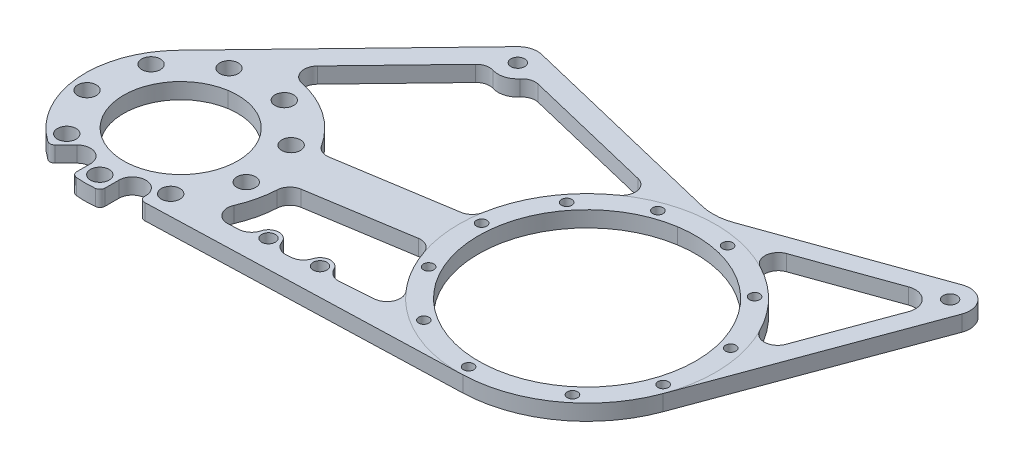
from build123d import *

# Parameters (mm, degrees)
SKETCH3_R             = 52.3875
SKETCH3_R_2           = 27.4955
SKETCH3_R_3           = 4.5
SKETCH3_R_4           = 3.3
BOSS_EXTRUDE2_DEPTH   = 7.62
CIRPATTERN3_OUTLINE_R = 2.5
CIRPATTERN3_DEPTH     = 7.62
CIRPATTERN4_OUTLINE_R = 4.5
CIRPATTERN4_DEPTH     = 7.62
CUT_EXTRUDE1_START    = -7.62
SKETCH5_R             = 3.3
CUT_EXTRUDE1_DEPTH    = 7.62
CUT_EXTRUDE2_START    = -7.62
CUT_EXTRUDE2_DEPTH    = 7.62
FILLET1_R             = 6.5024
FILLET2_R             = 25.4


# Read off the part's stored shape, not the designer's step: CirPattern3, CirPattern4
with BuildPart() as part:
    # Sketch3 → Boss-Extrude2 (new body)
    with BuildSketch(Plane(origin=(0, 0, 0), x_dir=(-1, 0, 0), z_dir=(0, 1, 0))):
        with BuildLine():
            ThreePointArc((-522.50478559, 169.998012211), (-516.00478559, 163.498012211), (-509.50478559, 169.998012211))
            Line((-509.50478559, 169.998012211), (-509.50478559, 176.570745001))
            ThreePointArc((-509.50478559, 176.570745001), (-508.847620296, 178.275600851), (-507.21617656, 179.098273949))
            ThreePointArc((-507.21617656, 179.098273949), (-502.666, 179.324), (-498.11582344, 179.098273949))
            ThreePointArc((-498.11582344, 179.098273949), (-496.484379704, 178.275600851), (-495.82721441, 176.570745001))
            Line((-495.82721441, 176.570745001), (-495.82721441, 169.998012211))
            ThreePointArc((-495.82721441, 169.998012211), (-491.814656721, 163.992795249), (-484.731020333, 165.401818133))
            Line((-484.731020333, 165.401818133), (-479.466136715, 170.666701751))
            ThreePointArc((-479.466136715, 170.666701751), (-477.888500119, 171.401242365), (-476.208336104, 170.947881552))
            ThreePointArc((-476.208336104, 170.947881552), (-456.900912757, 137.72783801), (-469.560234588, 101.449890714))
            Line((-469.560234588, 101.449890714), (-549.824285574, 18.152281318))
            ThreePointArc((-549.824285574, 18.152281318), (-554.019455529, 15.616475413), (-558.920153879, 15.502817016))
            Line((-558.920153879, 15.502817016), (-668.387105519, 41.950748201))
            Line((-668.387105519, 41.950748201), (-756.608134198, 10.378338241))
            ThreePointArc((-756.608134198, 10.378338241), (-766.585677978, 12.644204969), (-768.753729938, 22.643459071))
            Line((-768.753729938, 22.643459071), (-729.914918061, 127.907761748))
            ThreePointArc((-729.914918061, 127.907761748), (-708.037423823, 156.697788747), (-673.809574181, 168.357322083))
            Line((-673.809574181, 168.357322083), (-525.125998889, 173.113723975))
            ThreePointArc((-525.125998889, 173.113723975), (-523.277680865, 172.399561195), (-522.50478559, 170.575022653))
            Line((-522.50478559, 170.575022653), (-522.50478559, 169.998012211))
        make_face()
        with Locations(Location((-671.83, 106.476477371, 0), (0, 0, 270))):
            Circle(SKETCH3_R, mode=Mode.SUBTRACT)
        with Locations(Location((-502.666, 133.35, 0), (0, 0, 270))):
            Circle(SKETCH3_R_2, mode=Mode.SUBTRACT)
        with Locations(Location((-502.666, 172.35, 0), (0, 0, 270))):
            Circle(SKETCH3_R_3, mode=Mode.SUBTRACT)
        with Locations(Location((-556.683214872, 24.761419982, 0), (0, 0, 270))):
            Circle(SKETCH3_R_4, mode=Mode.SUBTRACT)
        with BuildLine():
            ThreePointArc((-757.653004828, 16.85543963), (-757.32668993, 21.510922268), (-761.982172567, 21.837237166))
            ThreePointArc((-761.982172567, 21.837237166), (-762.308487465, 17.181754528), (-757.653004828, 16.85543963))
        make_face(mode=Mode.SUBTRACT)
        with BuildLine():
            ThreePointArc((-671.83, 161.126477371), (-669.33, 163.626477371), (-671.83, 166.126477371))
            ThreePointArc((-671.83, 166.126477371), (-674.33, 163.626477371), (-671.83, 161.126477371))
        make_face(mode=Mode.SUBTRACT)
    extrude(amount=BOSS_EXTRUDE2_DEPTH)

    # CirPattern3 outline → CirPattern3 (cut)
    with BuildSketch(Plane(origin=(0, 0, 0), x_dir=(1, 0, 0), z_dir=(0, 1, 0))):
        with Locations((708.565311894, -150.255917295)):
            Circle(CIRPATTERN3_OUTLINE_R)
        with Locations((726.182879906, -124.1367986)):
            Circle(CIRPATTERN3_OUTLINE_R)
        with Locations((727.282400757, -92.650641038)):
            Circle(CIRPATTERN3_OUTLINE_R)
        with Locations((711.529725872, -65.366207782)):
            Circle(CIRPATTERN3_OUTLINE_R)
        with Locations((683.71215313, -50.575341989)):
            Circle(CIRPATTERN3_OUTLINE_R)
        with Locations((652.283548809, -52.773044093)):
            Circle(CIRPATTERN3_OUTLINE_R)
        with Locations((626.795185431, -71.291424056)):
            Circle(CIRPATTERN3_OUTLINE_R)
        with Locations((614.99307368, -100.502675695)):
            Circle(CIRPATTERN3_OUTLINE_R)
        with Locations((620.463920254, -131.52938841)):
            Circle(CIRPATTERN3_OUTLINE_R)
        with Locations((641.545114049, -154.942426066)):
            Circle(CIRPATTERN3_OUTLINE_R)
    extrude(amount=CIRPATTERN3_DEPTH, mode=Mode.SUBTRACT)

    # CirPattern4 outline → CirPattern4 (cut)
    with BuildSketch(Plane(origin=(0, 0, 0), x_dir=(1, 0, 0), z_dir=(0, 1, 0))):
        with Locations((527.734716778, -163.225733282)):
            Circle(CIRPATTERN4_OUTLINE_R)
        with Locations((541.073502367, -140.122278929)):
            Circle(CIRPATTERN4_OUTLINE_R)
        with Locations((536.440990748, -113.85)):
            Circle(CIRPATTERN4_OUTLINE_R)
        with Locations((516.00478559, -96.701987789)):
            Circle(CIRPATTERN4_OUTLINE_R)
        with Locations((489.32721441, -96.701987789)):
            Circle(CIRPATTERN4_OUTLINE_R)
        with Locations((468.891009252, -113.85)):
            Circle(CIRPATTERN4_OUTLINE_R)
        with Locations((464.258497633, -140.122278929)):
            Circle(CIRPATTERN4_OUTLINE_R)
        with Locations((477.597283222, -163.225733282)):
            Circle(CIRPATTERN4_OUTLINE_R)
    extrude(amount=CIRPATTERN4_DEPTH, mode=Mode.SUBTRACT)

    # Sketch5 → Cut-Extrude1 (cut)
    with BuildSketch(Plane(origin=(0, 7.62, 0), x_dir=(1, 0, 0), z_dir=(0, 1, 0)).offset(CUT_EXTRUDE1_START)):
        with BuildLine():
            ThreePointArc((732.639404166, -94.841443153), (715.822580319, -62.912610083), (684.05995867, -45.783926204))
            Line((684.05995867, -45.783926204), (744.580046671, -24.125087514))
            ThreePointArc((744.580046671, -24.125087514), (753.049499418, -26.048471827), (754.889853521, -34.536353413))
            Line((754.889853521, -34.536353413), (732.639404166, -94.841443153))
        make_face()
        with Locations(Location((593.980239809, -157.444184683, 0), (0, 0, 270))):
            Circle(SKETCH5_R)
        with Locations(Location((569.888269959, -158.214889119, 0), (0, 0, 270))):
            Circle(SKETCH5_R)
    extrude(amount=CUT_EXTRUDE1_DEPTH, mode=Mode.SUBTRACT)

    # Sketch7 → Cut-Extrude2 (cut)
    with BuildSketch(Plane(origin=(0, 7.62, 0), x_dir=(1, 0, 0), z_dir=(0, 1, 0)).offset(CUT_EXTRUDE2_START)):
        with BuildLine():
            Line((611.687447414, -121.174471272), (551.743357716, -130.697235281))
            ThreePointArc((551.743357716, -130.697235281), (549.774374245, -147.365180235), (542.311861973, -162.398749188))
            Line((542.311861973, -162.398749188), (565.922555759, -161.389713662))
            ThreePointArc((565.922555759, -161.389713662), (569.888269959, -153.134889119), (573.85398416, -161.389713662))
            Line((573.85398416, -161.389713662), (589.735446446, -160.234906687))
            ThreePointArc((589.735446446, -160.234906687), (593.611824631, -152.377561522), (598.584097222, -159.591484598))
            Line((598.584097222, -159.591484598), (635.87639113, -156.879807276))
            ThreePointArc((635.87639113, -156.879807276), (620.572456005, -141.201422869), (611.687447414, -121.174471272))
        make_face()
        with BuildLine():
            Line((610.237792236, -100.186994167), (546.113866061, -110.373770201))
            ThreePointArc((546.113866061, -110.373770201), (526.976498961, -90.634384106), (500.232040902, -84.261304314))
            Line((500.232040902, -84.261304314), (550.546041491, -32.045699486))
            ThreePointArc((550.546041491, -32.045699486), (559.346974214, -33.906364551), (565.772090985, -27.610622676))
            Line((565.772090985, -27.610622676), (650.951591186, -48.190546808))
            ThreePointArc((650.951591186, -48.190546808), (623.083120262, -68.307126157), (610.237792236, -100.186994167))
        make_face()
    extrude(amount=CUT_EXTRUDE2_DEPTH, mode=Mode.SUBTRACT)

    # Fillet1
    fillet1_edges = [part.edges().sort_by_distance(p)[0] for p in [
        (732.639404166, 3.81, 94.841443153),
        (684.05995867, 3.81, 45.783926204),
        (650.951591186, 3.81, 48.190546808),
        (610.237792236, 3.81, 100.186994167),
        (546.113866061, 3.81, 110.373770201),
        (500.232040902, 3.81, 84.261304314),
        (550.546041491, 3.81, 32.045699486),
        (565.772090985, 3.81, 27.610622676),
        (589.735446446, 3.81, 160.234906687),
        (573.85398416, 3.81, 161.389713662),
        (565.922555759, 3.81, 161.389713662),
        (542.311861973, 3.81, 162.398749188),
        (551.743357716, 3.81, 130.697235281),
        (611.687447414, 3.81, 121.174471272),
        (635.87639113, 3.81, 156.879807276),
        (598.584097222, 3.81, 159.591484598),
    ]]
    fillet(fillet1_edges, radius=FILLET1_R)

    # Fillet2
    fillet2_edges = [part.edges().sort_by_distance(p)[0] for p in [
        (668.387105519, 3.81, 41.950748201),
    ]]
    fillet(fillet2_edges, radius=FILLET2_R)


solid = part.part
